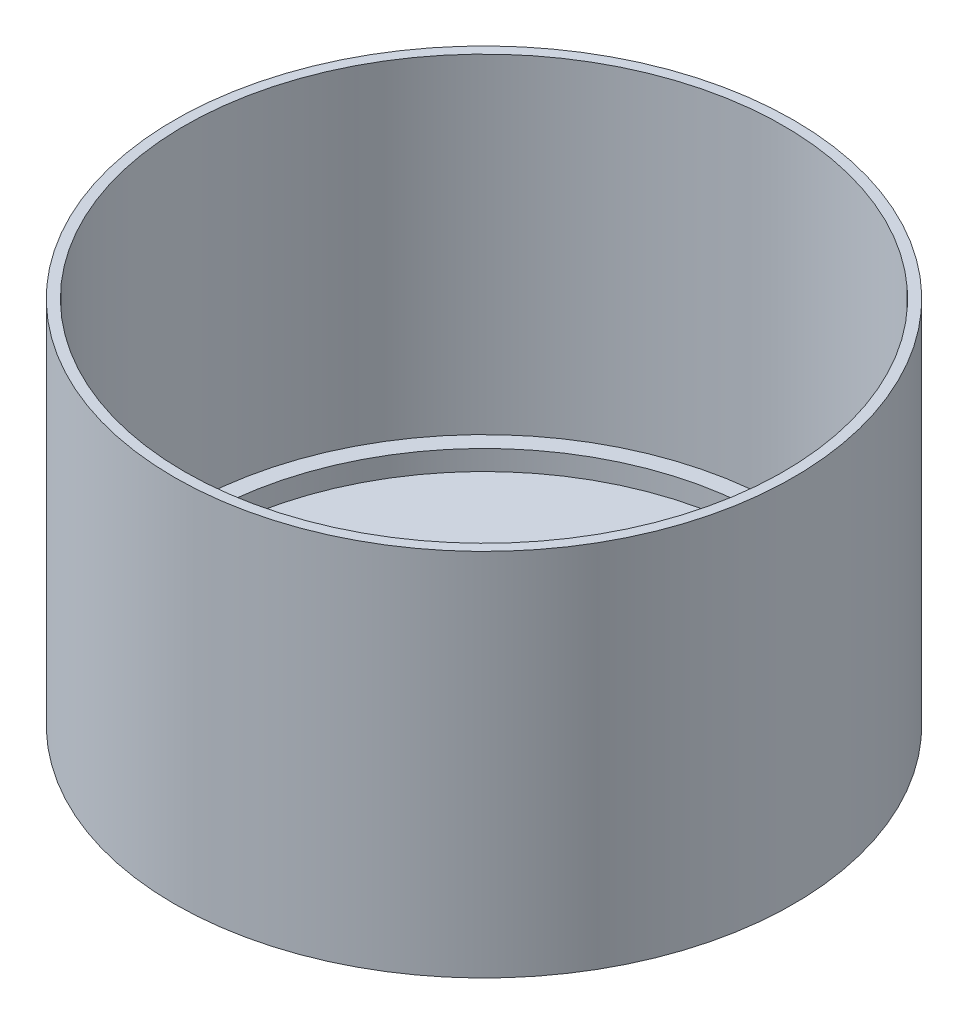
from build123d import *

# Parameters (mm, degrees)
SKETCH1_R           = 31
SKETCH1_R_2         = 30
BOSS_EXTRUDE1_DEPTH = 37
SKETCH2_R           = 31
BOSS_EXTRUDE2_DEPTH = 2
SKETCH5_R           = 30
SKETCH5_R_2         = 28.3
BOSS_EXTRUDE4_DEPTH = 2
SKETCH6_R           = 4
CUT_EXTRUDE1_DEPTH  = 2


with BuildPart() as part:
    # Sketch1 → Boss-Extrude1 (new body)
    with BuildSketch(Plane(origin=(0, 0, 0), x_dir=(1, 0, 0), z_dir=(0, 1, 0))):
        Circle(SKETCH1_R)
        Circle(SKETCH1_R_2, mode=Mode.SUBTRACT)
    extrude(amount=BOSS_EXTRUDE1_DEPTH)

    # Sketch2 → Boss-Extrude2 (add)
    with BuildSketch(Plane(origin=(0, 0, 0), x_dir=(1, 0, 0), z_dir=(0, 1, 0))):
        Circle(SKETCH2_R)
    extrude(amount=BOSS_EXTRUDE2_DEPTH)

    # Sketch5 → Boss-Extrude4 (add)
    with BuildSketch(Plane(origin=(0, 2, 0), x_dir=(1, 0, 0), z_dir=(0, 1, 0))):
        Circle(SKETCH5_R)
        Circle(SKETCH5_R_2, mode=Mode.SUBTRACT)
    extrude(amount=BOSS_EXTRUDE4_DEPTH)

    # Sketch6 → Cut-Extrude1 (cut)
    with BuildSketch(Plane(origin=(0, 2, 0), x_dir=(1, 0, 0), z_dir=(0, 1, 0))):
        Circle(SKETCH6_R)
    extrude(amount=-CUT_EXTRUDE1_DEPTH, mode=Mode.SUBTRACT)


solid = part.part
